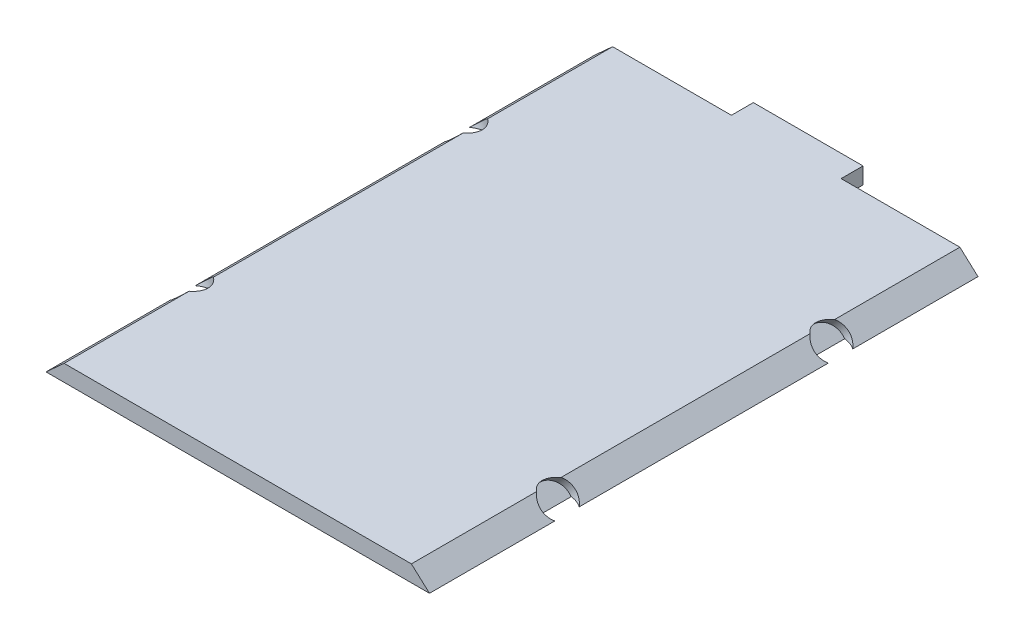
from build123d import *

# Parameters (mm, degrees)
BOSS_EXTRUDE1_DEPTH = 127
SKETCH2_W           = 25.4
SKETCH2_H           = 5.08
BOSS_EXTRUDE2_DEPTH = 3.81
SKETCH3_R           = 4
CUT_EXTRUDE1_DEPTH  = 2
SKETCH4_R           = 4
CUT_EXTRUDE2_DEPTH  = 2


with BuildPart() as part:
    # Sketch1 → Boss-Extrude1 (new body)
    with BuildSketch(Plane.XY):
        Polygon((-40.203883769, 5.937788296), (40.203883769, 5.937788296), (44.399042974, 2.127788296), (-44.399042974, 2.127788296), align=None)
    extrude(amount=BOSS_EXTRUDE1_DEPTH)

    # Sketch2 → Boss-Extrude2 (add)
    with BuildSketch(Plane.XZ.offset(-2.127788296)):
        with Locations((0, -2.54)):
            Rectangle(SKETCH2_W, SKETCH2_H)
    extrude(amount=-BOSS_EXTRUDE2_DEPTH)

    # Sketch3 → Cut-Extrude1 (cut)
    with BuildSketch(Plane(origin=(-21.127225221, 23.263011377, 0), x_dir=(0.7402720771062569, 0.6723074087475075, 0), z_dir=(-0.6723074087475075, 0.7402720771062569, 0))):
        with Locations((-28.603318705, -31.759163059)):
            Circle(SKETCH3_R)
        with Locations((-28.603318705, -95.240836941)):
            Circle(SKETCH3_R)
    extrude(amount=-CUT_EXTRUDE1_DEPTH, mode=Mode.SUBTRACT)

    # Sketch4 → Cut-Extrude2 (cut)
    with BuildSketch(Plane(origin=(21.127225221, 23.263011377, 0), x_dir=(0.7402720771062569, -0.6723074087475075, 0), z_dir=(0.6723074087475075, 0.7402720771062569, 0))):
        with Locations((28.603318705, -95.165699856)):
            Circle(SKETCH4_R)
        with Locations((28.603318705, -31.834300144)):
            Circle(SKETCH4_R)
    extrude(amount=-CUT_EXTRUDE2_DEPTH, mode=Mode.SUBTRACT)


solid = part.part
